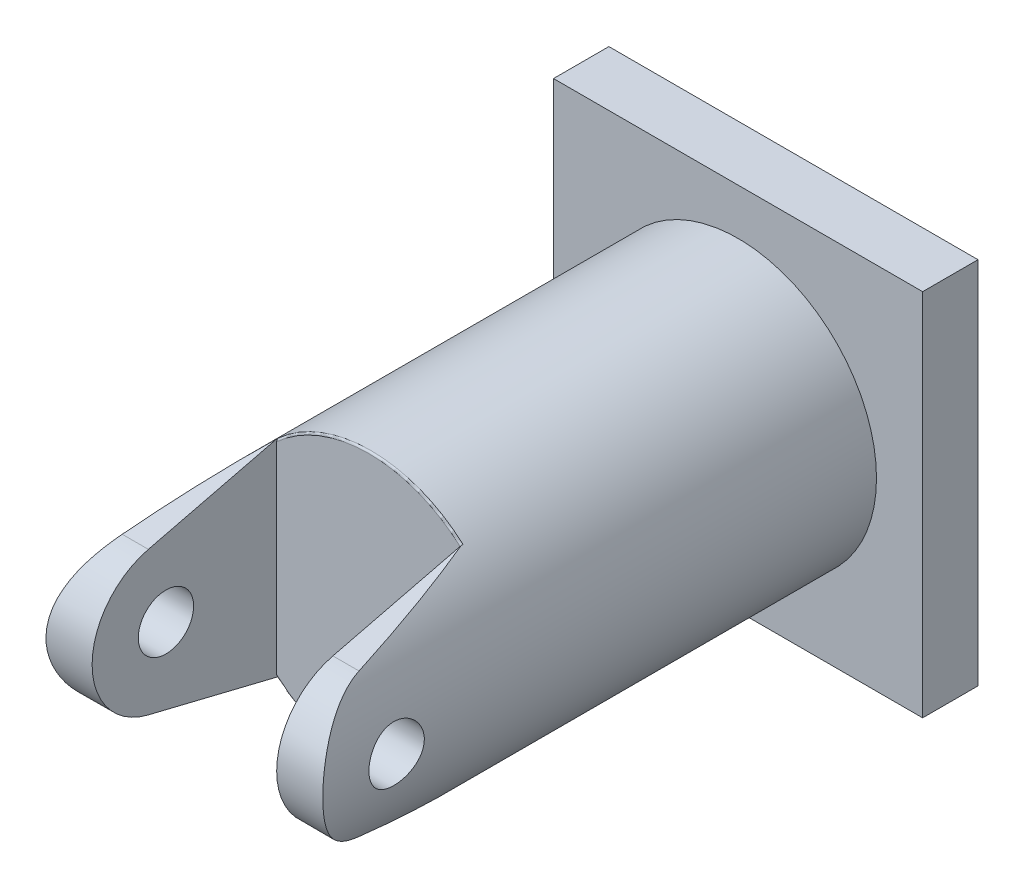
from build123d import *

# Parameters (mm, degrees)
SKETCH1_R               = 7.5
BOSS_EXTRUDE1_DEPTH     = 30
SKETCH3_W               = 10
SKETCH3_H               = 16
CUT_EXTRUDE2_DEPTH      = 10
CUT_EXTRUDE3_DEPTH      = 32.819805153
CUT_EXTRUDE3_DEPTH_BACK = 32.819805153
CUT_EXTRUDE4_DEPTH      = 32.819805295
CUT_EXTRUDE4_DEPTH_BACK = 32.819805295
SKETCH5_R               = 1.5
FILLET1_R               = 0.1
SKETCH6_W               = 20
SKETCH6_H               = 20
BOSS_EXTRUDE2_DEPTH     = 3


with BuildPart() as part:
    # Sketch1 → Boss-Extrude1 (new body)
    with BuildSketch(Plane.XY):
        Circle(SKETCH1_R)
    extrude(amount=BOSS_EXTRUDE1_DEPTH)

    # Sketch3 → Cut-Extrude2 (cut)
    with BuildSketch(Plane.XY.offset(30)):
        Rectangle(SKETCH3_W, SKETCH3_H)
    extrude(amount=-CUT_EXTRUDE2_DEPTH, mode=Mode.SUBTRACT)

    # Sketch4 → Cut-Extrude3 (cut, two sides: drawn at the far end of the back side and taken through both)
    with BuildSketch(Plane(origin=(0, 0, 0), x_dir=(0, 0, -1), z_dir=(1, 0, 0)).offset(-CUT_EXTRUDE3_DEPTH_BACK)):
        with BuildLine():
            Line((-20, 67.5), (-20, 7.5))
            Line((-20, 7.5), (-20, 5.590169944))
            Line((-20, 5.590169944), (-26.952923855, 3.884664175))
            ThreePointArc((-26.952923855, 3.884664175), (-29.999999999, -0.000262165), (-26.952744721, -3.885047998))
            Line((-26.952744721, -3.885047998), (-20, -5.590169944))
            Line((-20, -5.590169944), (-20, -7.5))
            Line((-20, -7.5), (-20, -67.5))
            Line((-20, -67.5), (-140, -67.5))
            Line((-140, -67.5), (-140, 67.5))
            Line((-140, 67.5), (-20, 67.5))
        make_face()
    extrude(amount=CUT_EXTRUDE3_DEPTH + CUT_EXTRUDE3_DEPTH_BACK, mode=Mode.SUBTRACT)

    # Sketch5 → Cut-Extrude4 (cut, two sides: drawn at the far end of the back side and taken through both)
    with BuildSketch(Plane(origin=(0, 0, 0), x_dir=(0, 0, -1), z_dir=(1, 0, 0)).offset(-CUT_EXTRUDE4_DEPTH_BACK)):
        with Locations(Location((-26, -0.000169944, 0), (0, 0, 0.006491373))):
            Circle(SKETCH5_R)
    extrude(amount=CUT_EXTRUDE4_DEPTH + CUT_EXTRUDE4_DEPTH_BACK, mode=Mode.SUBTRACT)

    # Fillet1
    # the kernel refuses this fillet: 0.1 mm, written as the material it takes off along each edge
    with BuildSketch(Plane(origin=(0, 0, 20), x_dir=(0.6911452834399253, -0.7227158481580055, 0), z_dir=(0.7227158481580055, 0.6911452834399253, 0))) as fillet1_piece_1_section:
        with BuildLine():
            CenterArc((7.5 - FILLET1_R, FILLET1_R), FILLET1_R, 270, 90)
            Line((7.5 - FILLET1_R, 0), (7.5, 0))
            Line((7.5, 0), (7.5, FILLET1_R))
        make_face()
    fillet1_piece_1 = revolve(axis=Axis((0, 0, 20), (0, 0, -1)), revolution_arc=87.441672972, mode=Mode.PRIVATE)
    fillet1_piece_1 = split(fillet1_piece_1, bisect_by=Plane(origin=(5, -5.569278589, 19.983070115), z_dir=(-1, 0, 0)), keep=Keep.TOP, mode=Mode.PRIVATE)
    fillet1_piece_1 = split(fillet1_piece_1, bisect_by=Plane(origin=(-5, -5.569278589, 19.983070115), z_dir=(1, 0, 0)), keep=Keep.TOP, mode=Mode.PRIVATE)
    add(fillet1_piece_1, mode=Mode.SUBTRACT)
    with BuildSketch(Plane(origin=(0, 0, 20), x_dir=(-0.6911452834399255, 0.7227158481580054, 0), z_dir=(-0.7227158481580054, -0.6911452834399255, 0))) as fillet1_piece_2_section:
        with BuildLine():
            CenterArc((7.5 - FILLET1_R, FILLET1_R), FILLET1_R, 270, 90)
            Line((7.5 - FILLET1_R, 0), (7.5, 0))
            Line((7.5, 0), (7.5, FILLET1_R))
        make_face()
    fillet1_piece_2 = revolve(axis=Axis((0, 0, 20), (0, 0, -1)), revolution_arc=87.441672972, mode=Mode.PRIVATE)
    fillet1_piece_2 = split(fillet1_piece_2, bisect_by=Plane(origin=(5, 5.569279486, 19.983069507), z_dir=(-1, 0, 0)), keep=Keep.TOP, mode=Mode.PRIVATE)
    fillet1_piece_2 = split(fillet1_piece_2, bisect_by=Plane(origin=(-5, 5.569279486, 19.983069507), z_dir=(1, 0, 0)), keep=Keep.TOP, mode=Mode.PRIVATE)
    add(fillet1_piece_2, mode=Mode.SUBTRACT)

    # Sketch6 → Boss-Extrude2 (add)
    with BuildSketch(Plane(origin=(0, 0, 0), x_dir=(-1, 0, 0), z_dir=(0, 0, -1))):
        Rectangle(SKETCH6_W, SKETCH6_H)
    extrude(amount=BOSS_EXTRUDE2_DEPTH)


solid = part.part
